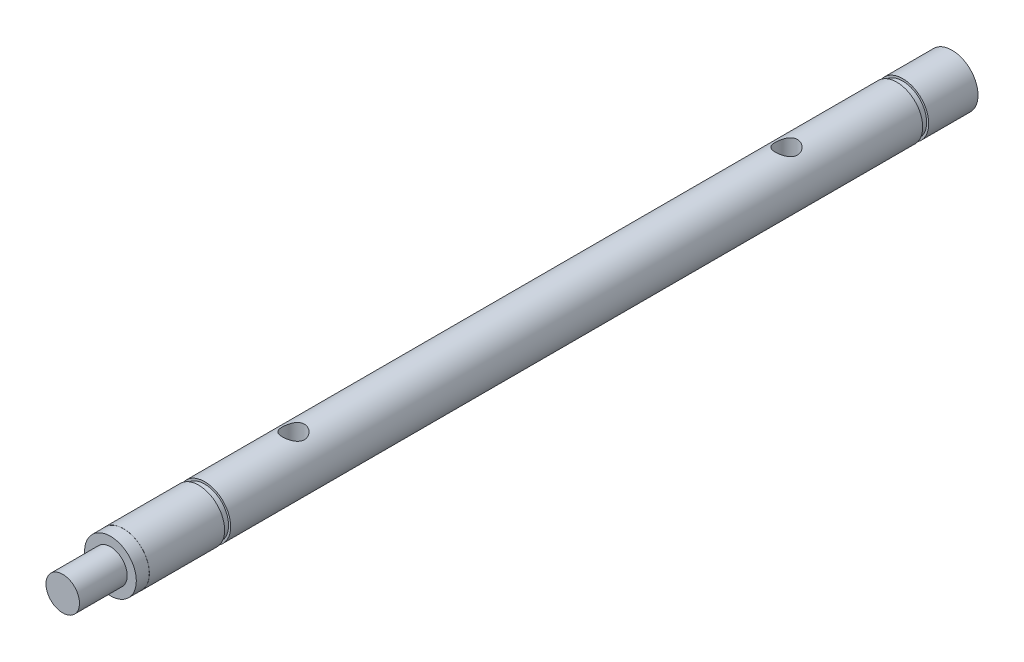
from build123d import *

# Parameters (mm, degrees)
F_6_32_TAPPED_HOLE1_D     = 2.7051
F_6_32_TAPPED_HOLE1_DEPTH = 9.398
F_6_32_TAPPED_HOLE1_TIP   = 0.81269403


with BuildPart() as part:
    # Sketch1 → Revolve1 (revolve)
    with BuildSketch(Plane(origin=(0, 0, 0), x_dir=(1, 0, 0), z_dir=(0, 1, 0))):
        Polygon((3.175, 93.769403682), (3.175, 99.795553682), (0, 99.795553682), (0, -9.017), (2.05, -9.017), (2.05, -3.175), (3.1623, -3.175), (3.1623, -1.5875), (3.175, -1.5875), (3.175, 7.62), (2.921, 7.62), (2.921, 8.3566), (3.175, 8.3566), (3.175, 93.032803682), (2.921, 93.032803682), (2.921, 93.769403682), align=None)
    revolve(axis=Axis((0, 0, 9.017), (0, 0, -1)))

    # #6-32 Tapped Hole1
    with Locations(Plane(origin=(0, -3.175, 0), x_dir=(-1, 0, 0), z_dir=(0, -1, 0))):
        with Locations((0, 79.530799572), (0, 19.205799572)):
            Hole(F_6_32_TAPPED_HOLE1_D / 2, depth=F_6_32_TAPPED_HOLE1_DEPTH)
            with Locations((0, 0, -(F_6_32_TAPPED_HOLE1_DEPTH + F_6_32_TAPPED_HOLE1_TIP / 2))):  # 118° drill point
                Cone(0, F_6_32_TAPPED_HOLE1_D / 2, F_6_32_TAPPED_HOLE1_TIP, mode=Mode.SUBTRACT)


solid = part.part
